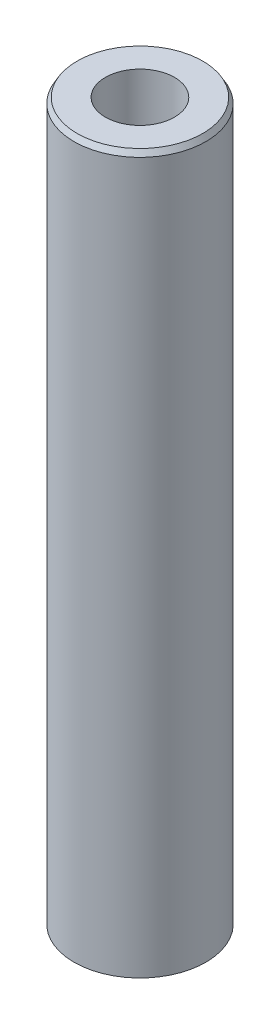
from build123d import *
from OCP.BRepFilletAPI import BRepFilletAPI_MakeChamfer

# Parameters (mm, degrees)
SKETCH1_R           = 55
BOSS_EXTRUDE1_DEPTH = 600
SKETCH2_R           = 28.817485362
CUT_EXTRUDE1_DEPTH  = 606.020660804
CHAMFER1_SIZE       = 4.549408309
CHAMFER1_SIZE2      = 2.626602112


with BuildPart() as part:
    # Sketch1 → Boss-Extrude1 (new body)
    with BuildSketch(Plane(origin=(0, 0, 0), x_dir=(1, 0, 0), z_dir=(0, 1, 0))):
        Circle(SKETCH1_R)
    extrude(amount=BOSS_EXTRUDE1_DEPTH)

    # Sketch2 → Cut-Extrude1 (cut, through all)
    with BuildSketch(Plane(origin=(0, 0, 0), x_dir=(1, 0, 0), z_dir=(0, 1, 0))):
        Circle(SKETCH2_R)
    extrude(amount=CUT_EXTRUDE1_DEPTH, mode=Mode.SUBTRACT)

    # Chamfer1: one chamfer whose edges measure the first distance from different faces: ONE call of the kernel's chamfer builder (chamfer() names one face for all edges)
    chamfer1_edges_1 = [part.edges().sort_by_distance(p)[0] for p in [
        (-55, 600, 0),
    ]]
    chamfer1_side_1 = [part.faces().sort_by_distance(p)[0] for p in [
        (-55, 300, 0),
    ]]
    chamfer1_edges_2 = [part.edges().sort_by_distance(p)[0] for p in [
        (-55, 0, 0),
    ]]
    chamfer1_side_2 = [part.faces().sort_by_distance(p)[0] for p in [
        (-53.444365081, 0, 0),
    ]]
    chamfer1 = BRepFilletAPI_MakeChamfer(part.part.solid().wrapped)
    for e in chamfer1_edges_1:
        chamfer1.Add(CHAMFER1_SIZE, CHAMFER1_SIZE2, e.wrapped, chamfer1_side_1[0].wrapped)  # the first distance lies on this face
    for e in chamfer1_edges_2:
        chamfer1.Add(CHAMFER1_SIZE, CHAMFER1_SIZE2, e.wrapped, chamfer1_side_2[0].wrapped)  # the first distance lies on this face
    add(Compound.cast(chamfer1.Shape()), mode=Mode.REPLACE)


solid = part.part
